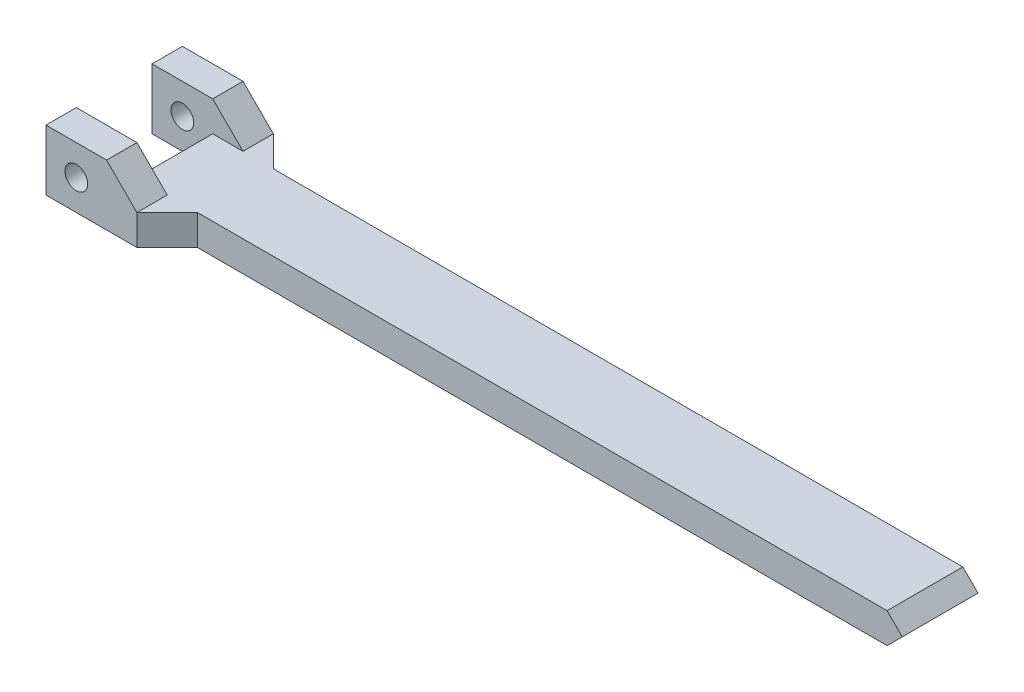
from build123d import *

# Parameters (mm, degrees)
SZKIC1_W                         = 101
SZKIC1_H                         = 10
DODANIE_WYCI_GNI_CIE1_DEPTH      = 4
DODANIE_WYCI_GNI_CIE2_DEPTH      = 8
DODANIE_WYCI_GNI_CIE2_DEPTH_BACK = 4
SZKIC2_W                         = 4
SZKIC2_H                         = 8
SFAZOWANIE1_SIZE                 = 4
SFAZOWANIE2_SIZE                 = 4
WYTNIJ_WYCI_GNI_CIE1_DEPTH       = 62.72722252
WYTNIJ_WYCI_GNI_CIE1_DEPTH_BACK  = 62.72722252
SZKIC4_R                         = 1.5
SFAZOWANIE3_SIZE                 = 2


# Some blends are built 0.0001 mm under size
with BuildPart() as part:
    # Szkic1 → Dodanie-wyciągnięcie1 (new body)
    with BuildSketch(Plane(origin=(0, 0, 0), x_dir=(1, 0, 0), z_dir=(0, 1, 0))):
        Rectangle(SZKIC1_W, SZKIC1_H)
    extrude(amount=DODANIE_WYCI_GNI_CIE1_DEPTH)

    # Szkic2 → Dodanie-wyciągnięcie2 (add, two sides: drawn at the far end of the back side and taken through both)
    with BuildSketch(Plane.ZY.offset(50.5).offset(-DODANIE_WYCI_GNI_CIE2_DEPTH_BACK)):
        with Locations((-7, 4)):
            Rectangle(SZKIC2_W, SZKIC2_H)
        with Locations((7, 4)):
            Rectangle(SZKIC2_W, SZKIC2_H)
    extrude(amount=DODANIE_WYCI_GNI_CIE2_DEPTH + DODANIE_WYCI_GNI_CIE2_DEPTH_BACK)

    # Sfazowanie1
    sfazowanie1_edges = [part.edges().sort_by_distance(p)[0] for p in [
        (-46.5, 8, -7),
        (-46.5, 8, 7),
    ]]
    chamfer(sfazowanie1_edges, length=SFAZOWANIE1_SIZE)

    # Sfazowanie2
    # the kernel refuses this chamfer: 4 mm, written as the material it adds along each edge
    with BuildSketch(Plane(origin=(-46.5, 0, -5), x_dir=(0.9996219169112968, 0, 0.027495876610586296), z_dir=(0, 1, 0))) as sfazowanie2_piece_1_section:
        Polygon((SFAZOWANIE2_SIZE * 0.999621916911, SFAZOWANIE2_SIZE * 0.0274958766106), (-SFAZOWANIE2_SIZE * 0.0274958766106, SFAZOWANIE2_SIZE * 0.999621916911), (0, 0), align=None)
    sfazowanie2_piece_1 = extrude(amount=4, mode=Mode.PRIVATE)
    sfazowanie2_piece_1 = split(sfazowanie2_piece_1, bisect_by=Plane(origin=(-45.556052557, 1.526245094, -9), z_dir=(0, 0, 1)), keep=Keep.TOP, mode=Mode.PRIVATE)
    sfazowanie2_piece_1 = split(sfazowanie2_piece_1, bisect_by=Plane(origin=(-44.791148825, 2.291148825, -6.514062333), z_dir=(-0.7071067811865476, -0.7071067811865476, 0)), keep=Keep.TOP, mode=Mode.PRIVATE)
    add(sfazowanie2_piece_1)
    with BuildSketch(Plane(origin=(-46.5, 0, -5), x_dir=(0.9996219169112968, 0, 0.027495876610586296), z_dir=(0, 1, 0))) as sfazowanie2_piece_2_section:
        Polygon((SFAZOWANIE2_SIZE * 0.999621916911, SFAZOWANIE2_SIZE * 0.0274958766106), (-SFAZOWANIE2_SIZE * 0.0274958766106, SFAZOWANIE2_SIZE * 0.999621916911), (0, 0), align=None)
    sfazowanie2_piece_2 = extrude(amount=4, mode=Mode.PRIVATE)
    sfazowanie2_piece_2 = split(sfazowanie2_piece_2, bisect_by=Plane(origin=(-44.936302596, 2.436302596, -5.911229734), z_dir=(0.7071067811865476, 0.7071067811865476, 0)), keep=Keep.TOP, mode=Mode.PRIVATE)
    add(sfazowanie2_piece_2)
    with BuildSketch(Plane(origin=(-46.5, 4, 5), x_dir=(-0.027495876610585623, 0, 0.9996219169112968), z_dir=(0, -1, 0))) as sfazowanie2_piece_3_section:
        Polygon((SFAZOWANIE2_SIZE * 0.999621916911, -SFAZOWANIE2_SIZE * 0.0274958766106), (-SFAZOWANIE2_SIZE * 0.0274958766106, -SFAZOWANIE2_SIZE * 0.999621916911), (0, 0), align=None)
    sfazowanie2_piece_3 = extrude(amount=4, mode=Mode.PRIVATE)
    sfazowanie2_piece_3 = split(sfazowanie2_piece_3, bisect_by=Plane(origin=(-44.936302596, 2.436302596, 5.911229734), z_dir=(0.7071067811865476, 0.7071067811865476, 0)), keep=Keep.TOP, mode=Mode.PRIVATE)
    add(sfazowanie2_piece_3)
    with BuildSketch(Plane(origin=(-46.5, 4, 5), x_dir=(-0.027495876610585623, 0, 0.9996219169112968), z_dir=(0, -1, 0))) as sfazowanie2_piece_4_section:
        Polygon((SFAZOWANIE2_SIZE * 0.999621916911, -SFAZOWANIE2_SIZE * 0.0274958766106), (-SFAZOWANIE2_SIZE * 0.0274958766106, -SFAZOWANIE2_SIZE * 0.999621916911), (0, 0), align=None)
    sfazowanie2_piece_4 = extrude(amount=4, mode=Mode.PRIVATE)
    sfazowanie2_piece_4 = split(sfazowanie2_piece_4, bisect_by=Plane(origin=(-45.556052557, 1.526245094, 9), z_dir=(0, 0, -1)), keep=Keep.TOP, mode=Mode.PRIVATE)
    sfazowanie2_piece_4 = split(sfazowanie2_piece_4, bisect_by=Plane(origin=(-44.791148825, 2.291148825, 6.514062333), z_dir=(-0.7071067811865476, -0.7071067811865476, 0)), keep=Keep.TOP, mode=Mode.PRIVATE)
    add(sfazowanie2_piece_4)

    # Szkic4 → Wytnij-wyciągnięcie1 (cut, two sides: drawn at the far end of the back side and taken through both)
    with BuildSketch(Plane.XY.offset(9).offset(-WYTNIJ_WYCI_GNI_CIE1_DEPTH_BACK)):
        with Locations((-54.5, 4)):
            Circle(SZKIC4_R)
    extrude(amount=WYTNIJ_WYCI_GNI_CIE1_DEPTH + WYTNIJ_WYCI_GNI_CIE1_DEPTH_BACK, mode=Mode.SUBTRACT)

    # Sfazowanie3
    sfazowanie3_edges = [part.edges().sort_by_distance(p)[0] for p in [
        (50.5, 4, 0),
        (50.5, 0, 0),
    ]]
    chamfer(sfazowanie3_edges, length=SFAZOWANIE3_SIZE - 0.0001)  # a hair under: the kernel refuses the full size


solid = part.part
